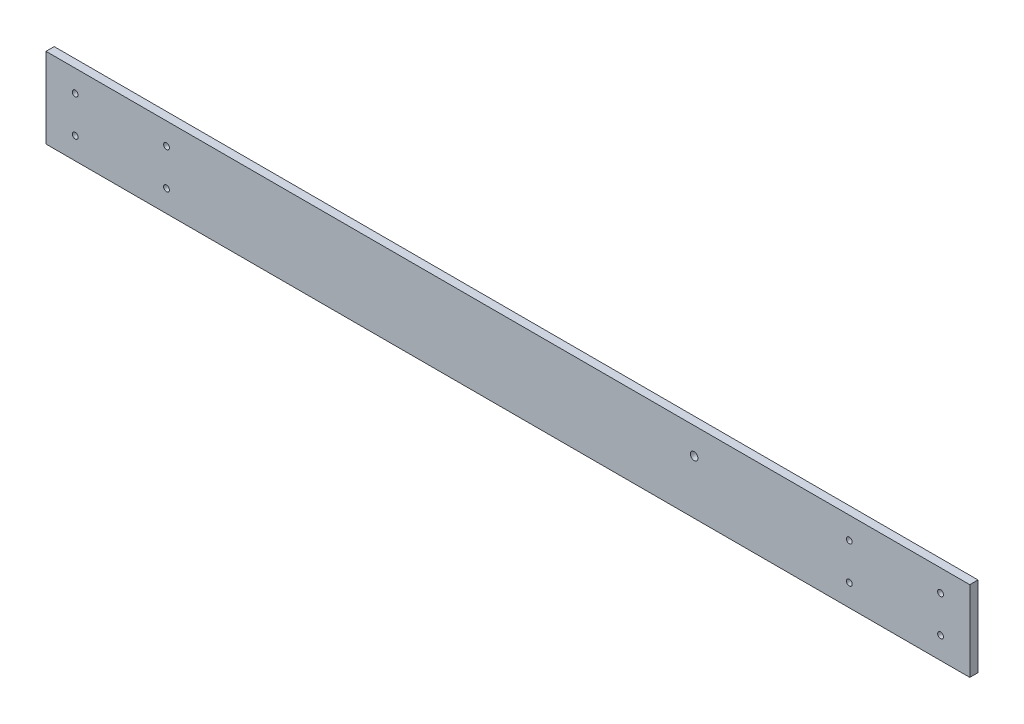
from build123d import *

# Parameters (mm, degrees)
SKETCH2_W           = 506
SKETCH2_H           = 44
SKETCH2_R           = 2.1
SKETCH2_R_2         = 1.6
BOSS_EXTRUDE1_DEPTH = 4.5


with BuildPart() as part:
    # Sketch2 → Boss-Extrude1 (new body)
    with BuildSketch(Plane.XY):
        Rectangle(SKETCH2_W, SKETCH2_H)
        with Locations((102, 7.5)):
            Circle(SKETCH2_R, mode=Mode.SUBTRACT)
        with Locations((237, 10)):
            Circle(SKETCH2_R_2, mode=Mode.SUBTRACT)
        with Locations((187, 10)):
            Circle(SKETCH2_R_2, mode=Mode.SUBTRACT)
        with Locations((187, -10)):
            Circle(SKETCH2_R_2, mode=Mode.SUBTRACT)
        with Locations((237, -10)):
            Circle(SKETCH2_R_2, mode=Mode.SUBTRACT)
        with Locations((-187, 10)):
            Circle(SKETCH2_R_2, mode=Mode.SUBTRACT)
        with Locations((-187, -10)):
            Circle(SKETCH2_R_2, mode=Mode.SUBTRACT)
        with Locations((-237, -10)):
            Circle(SKETCH2_R_2, mode=Mode.SUBTRACT)
        with Locations((-237, 10)):
            Circle(SKETCH2_R_2, mode=Mode.SUBTRACT)
    extrude(amount=BOSS_EXTRUDE1_DEPTH)


solid = part.part
